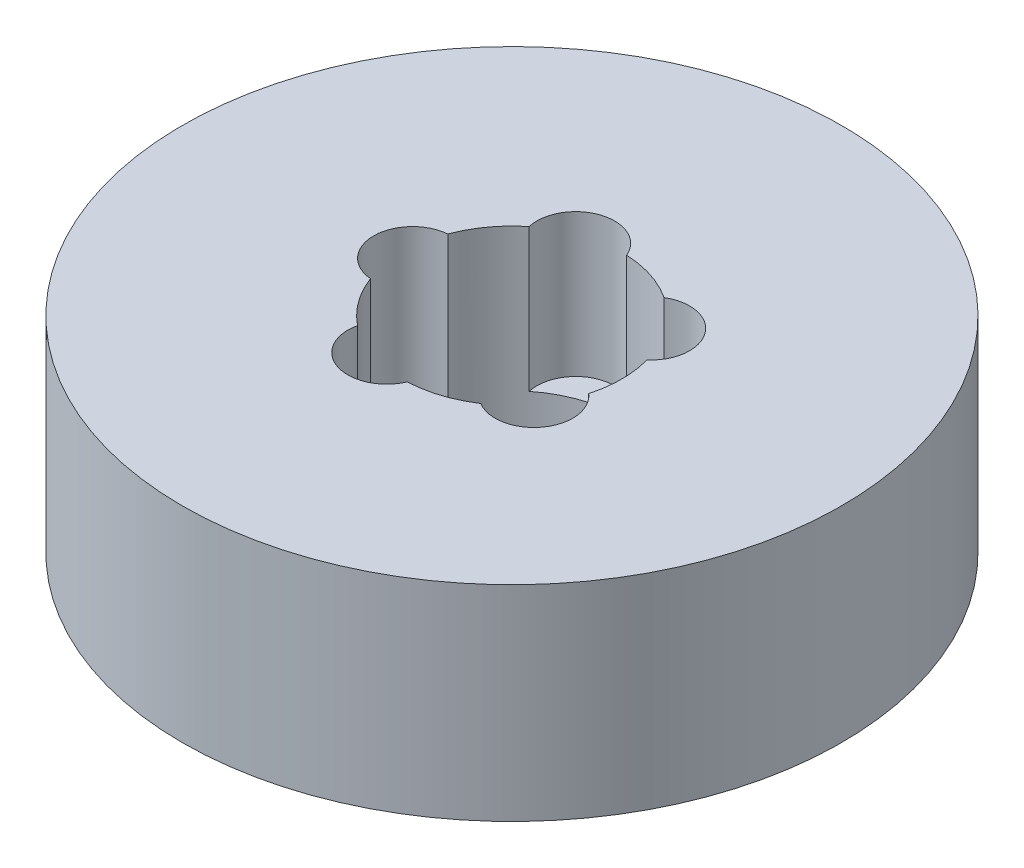
from build123d import *

# Parameters (mm, degrees)
SKETCH1_R           = 22.5
BOSS_EXTRUDE1_DEPTH = 14
SKETCH2_R           = 7.5
CUT_EXTRUDE1_DEPTH  = 35.763486592
SKETCH3_R           = 2.652458734
CUT_EXTRUDE2_DEPTH  = 9.747693971
CIRPATTERN1_COUNT   = 5


with BuildPart() as part:
    # Sketch1 → Boss-Extrude1 (new body)
    with BuildSketch(Plane(origin=(0, 0, 0), x_dir=(1, 0, 0), z_dir=(0, 1, 0))):
        Circle(SKETCH1_R)
    extrude(amount=BOSS_EXTRUDE1_DEPTH)

    # Sketch2 → Cut-Extrude1 (cut, through all)
    with BuildSketch(Plane(origin=(0, 0, 0), x_dir=(1, 0, 0), z_dir=(0, 1, 0))):
        Circle(SKETCH2_R)
    extrude(amount=CUT_EXTRUDE1_DEPTH, mode=Mode.SUBTRACT)

    # Sketch3 → Cut-Extrude2 (cut)
    with BuildSketch(Plane(origin=(0, 14, 0), x_dir=(1, 0, 0), z_dir=(0, 1, 0))):
        with Locations((-6.786406221, 0)):
            Circle(SKETCH3_R)
    cut_extrude2 = extrude(amount=-CUT_EXTRUDE2_DEPTH, mode=Mode.SUBTRACT)

    # CirPattern1: Cut-Extrude2 ×5 about axis
    cirpattern1_axis = Axis((0, 0, 0), (0, 1, 0))
    for i in range(1, CIRPATTERN1_COUNT):
        add(cut_extrude2.rotate(cirpattern1_axis, i * 360 / CIRPATTERN1_COUNT), mode=Mode.SUBTRACT)


solid = part.part
